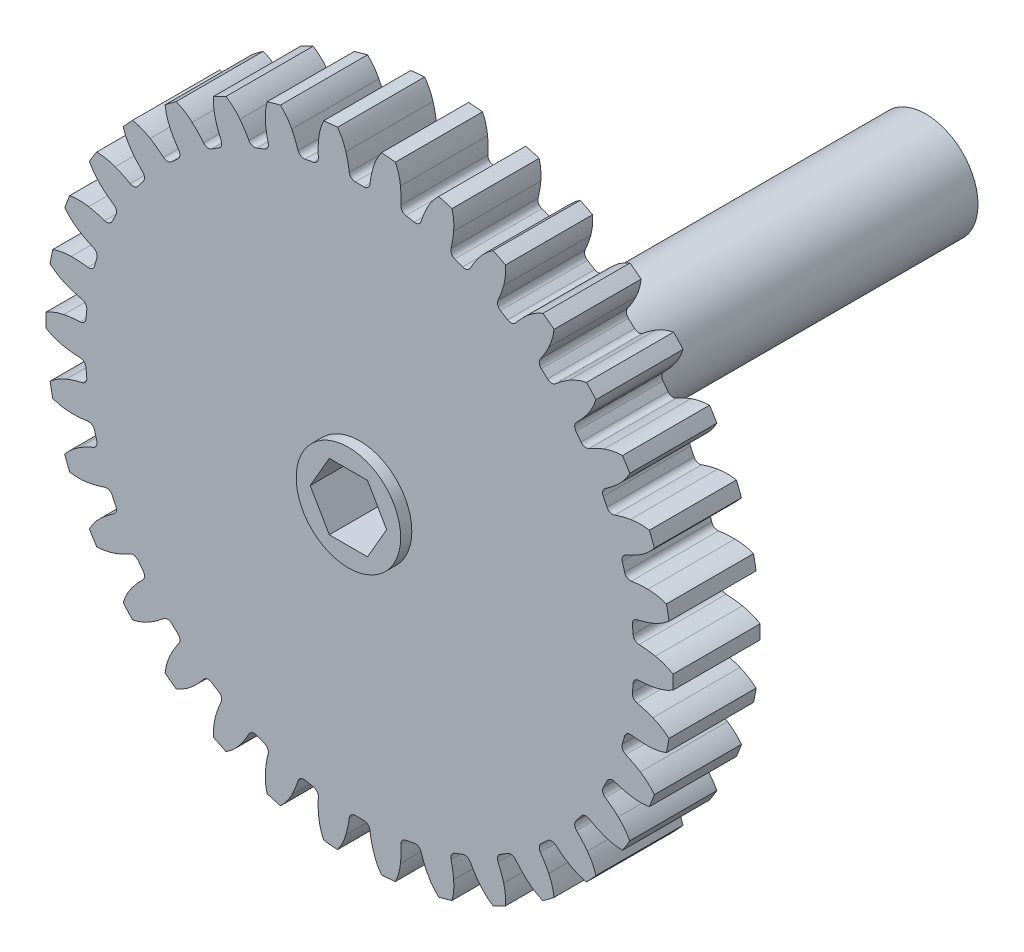
from build123d import *

# Parameters (mm, degrees)
SKETCH1_R           = 22.86
ROUND_STOCK_DEPTH   = 3.175
SINGLE_TOOTH_DEPTH  = 33.946649299
TOOTH_PATTERN_COUNT = 34
CUT_EXTRUDE1_DEPTH  = 33.907595949
SKETCH8_R           = 3.81
BOSS_EXTRUDE1_DEPTH = 34.925
CHAMFER1_SIZE       = 1.27
BOSS_EXTRUDE2_START = 0.8128
SKETCH9_R           = 3.81
BOSS_EXTRUDE2_DEPTH = 0.8128


with BuildPart() as part:
    # Sketch1 → Round Stock (new, symmetric)
    with BuildSketch(Plane.XY):
        Circle(SKETCH1_R)
    extrude(amount=ROUND_STOCK_DEPTH, both=True)

    # Sketch2 → Single Tooth (cut, through all)
    with BuildSketch(Plane.XY.offset(3.175)):
        with BuildLine():
            ThreePointArc((-22.558432369, -3.700909222), (-22.76248327, -2.109254697), (-22.854372474, -0.507206861))
            ThreePointArc((-22.854372474, -0.507206861), (-22.231979391, -0.808376737), (-21.566940538, -0.997585))
            ThreePointArc((-21.566940538, -0.997585), (-20.971743487, -1.08827056), (-20.371269004, -1.132017494))
            ThreePointArc((-20.371269004, -1.132017494), (-20.07878157, -1.255170527), (-19.942974638, -1.542001568))
            ThreePointArc((-19.942974638, -1.542001568), (-19.917172861, -1.84559786), (-19.886749641, -2.148765913))
            ThreePointArc((-19.886749641, -2.148765913), (-19.967539137, -2.455667568), (-20.232417106, -2.630468111))
            ThreePointArc((-20.232417106, -2.630468111), (-20.814628892, -2.783807068), (-21.383028154, -2.982315705))
            ThreePointArc((-21.383028154, -2.982315705), (-22.00197653, -3.290502907), (-22.558432369, -3.700909222))
        make_face()
    single_tooth = extrude(amount=-SINGLE_TOOTH_DEPTH, mode=Mode.SUBTRACT)

    # Tooth Pattern: Single Tooth ×34 about axis
    tooth_pattern_axis = Axis((0, 0, 50), (0, 0, -1))
    for i in range(1, TOOTH_PATTERN_COUNT):
        add(single_tooth.rotate(tooth_pattern_axis, i * 360 / TOOTH_PATTERN_COUNT), mode=Mode.SUBTRACT)

    # Sketch7 → Cut-Extrude1 (cut, through all)
    with BuildSketch(Plane(origin=(0, 0, -3.175), x_dir=(-1, 0, 0), z_dir=(0, 0, -1))):
        Polygon((1.3931462, -2.413), (2.786292399, 0), (1.3931462, 2.413), (-1.3931462, 2.413), (-2.786292399, 0), (-1.3931462, -2.413), align=None)
    extrude(amount=-CUT_EXTRUDE1_DEPTH, mode=Mode.SUBTRACT)

    # Sketch8 → Boss-Extrude1 (add)
    with BuildSketch(Plane(origin=(0, 0, -3.175), x_dir=(-1, 0, 0), z_dir=(0, 0, -1))):
        Circle(SKETCH8_R)
        Polygon((1.3931462, -2.413), (2.786292399, 0), (1.3931462, 2.413), (-1.3931462, 2.413), (-2.786292399, 0), (-1.3931462, -2.413), align=None, mode=Mode.SUBTRACT)
    extrude(amount=BOSS_EXTRUDE1_DEPTH)

    # Chamfer1
    chamfer1_edges = [part.edges().sort_by_distance(p)[0] for p in [
        (3.81, 0, -3.175),
    ]]
    chamfer(chamfer1_edges, length=CHAMFER1_SIZE)

    # Sketch9 → Boss-Extrude2 (add)
    with BuildSketch(Plane.XY.offset(3.175).offset(BOSS_EXTRUDE2_START)):
        Circle(SKETCH9_R)
        Polygon((-1.3931462, -2.413), (1.3931462, -2.413), (2.786292399, 0), (1.3931462, 2.413), (-1.3931462, 2.413), (-2.786292399, 0), align=None, mode=Mode.SUBTRACT)
    extrude(amount=-BOSS_EXTRUDE2_DEPTH)


solid = part.part
